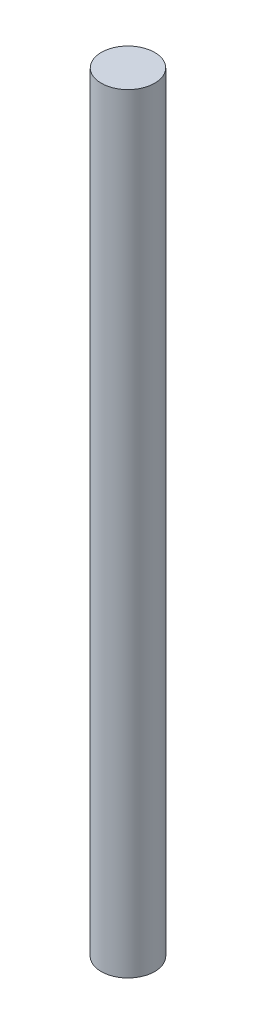
from build123d import *

# Parameters (mm, degrees)
SKETCH1_R           = 3.96875
BOSS_EXTRUDE1_DEPTH = 114.3


with BuildPart() as part:
    # Sketch1 → Boss-Extrude1 (new body)
    with BuildSketch(Plane(origin=(0, 0, 0), x_dir=(1, 0, 0), z_dir=(0, 1, 0))):
        Circle(SKETCH1_R)
    extrude(amount=BOSS_EXTRUDE1_DEPTH)


solid = part.part
